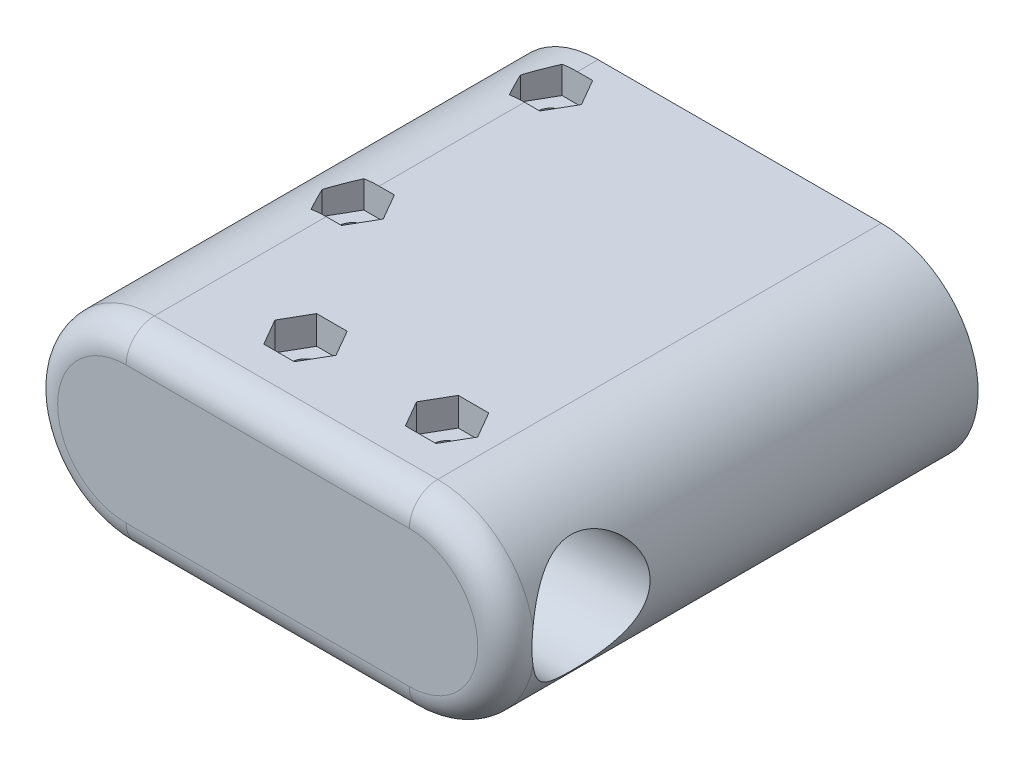
from build123d import *

# Parameters (mm, degrees)
SKETCH1_R           = 6.25
SKETCH1_R_2         = 4.25
BOSS_EXTRUDE1_DEPTH = 50
CUT_EXTRUDE1_DEPTH  = 127
BOSS_EXTRUDE2_DEPTH = 20
SKETCH4_R           = 6.25
CUT_EXTRUDE2_DEPTH  = 20
CUT_EXTRUDE3_START  = -30
SKETCH5_R           = 6.25
CUT_EXTRUDE3_DEPTH  = 30
FILLET1_R           = 3
SKETCH6_R           = 4.5
BOSS_EXTRUDE3_DEPTH = 30
SKETCH7_R           = 1.5
CUT_EXTRUDE4_DEPTH  = 30
CUT_EXTRUDE5_DEPTH  = 3


with BuildPart() as part:
    # Sketch1 → Boss-Extrude1 (new body)
    with BuildSketch(Plane.XY):
        with BuildLine():
            Line((-73.62208004, 11.83829087), (106.37791996, 11.83829087))
            ThreePointArc((106.37791996, 11.83829087), (116.62791996, 1.58829087), (106.37791996, -8.66170913))
            Line((106.37791996, -8.66170913), (-73.62208004, -8.66170913))
            ThreePointArc((-73.62208004, -8.66170913), (-83.87208004, 1.58829087), (-73.62208004, 11.83829087))
        make_face()
        with Locations((-73.62208004, 1.58829087)):
            Circle(SKETCH1_R, mode=Mode.SUBTRACT)
        with Locations((-43.62208004, 1.58829087)):
            Circle(SKETCH1_R_2, mode=Mode.SUBTRACT)
        with Locations(Location((76.37791996, 1.58829087, 0), (0, 0, 180))):
            Circle(SKETCH1_R_2, mode=Mode.SUBTRACT)
        with Locations(Location((106.37791996, 1.58829087, 0), (0, 0, 180))):
            Circle(SKETCH1_R, mode=Mode.SUBTRACT)
    extrude(amount=BOSS_EXTRUDE1_DEPTH)

    # Sketch2 → Cut-Extrude1 (cut)
    with BuildSketch(Plane.XY.offset(50)):
        with BuildLine():
            Line((-43.62208004, 11.83829087), (132.206329773, 11.83829087))
            Line((132.206329773, 11.83829087), (132.206329773, -8.66170913))
            Line((132.206329773, -8.66170913), (-43.62208004, -8.66170913))
            ThreePointArc((-43.62208004, -8.66170913), (-33.37208004, 1.58829087), (-43.62208004, 11.83829087))
        make_face()
    extrude(amount=-CUT_EXTRUDE1_DEPTH, mode=Mode.SUBTRACT)

    # Sketch3 → Boss-Extrude2 (add)
    with BuildSketch(Plane.XY.offset(50)):
        with BuildLine():
            Line((-43.62208004, 11.83829087), (-73.62208004, 11.83829087))
            ThreePointArc((-73.62208004, 11.83829087), (-83.87208004, 1.58829087), (-73.62208004, -8.66170913))
            Line((-73.62208004, -8.66170913), (-43.62208004, -8.66170913))
            ThreePointArc((-43.62208004, -8.66170913), (-33.37208004, 1.58829087), (-43.62208004, 11.83829087))
        make_face()
    extrude(amount=-BOSS_EXTRUDE2_DEPTH)

    # Sketch4 → Cut-Extrude2 (cut)
    with BuildSketch(Plane.ZY.offset(43.62208004)):
        with Locations(Location((41, 1.58829087, 0), (0, 0, 270))):
            Circle(SKETCH4_R)
    extrude(amount=-CUT_EXTRUDE2_DEPTH, mode=Mode.SUBTRACT)

    # Sketch5 → Cut-Extrude3 (cut)
    with BuildSketch(Plane(origin=(-43.62208004, 0, 0), x_dir=(0, 0, -1), z_dir=(1, 0, 0)).offset(CUT_EXTRUDE3_START)):
        with Locations(Location((-41, 1.58829087, 0), (0, 0, 270))):
            Circle(SKETCH5_R)
    extrude(amount=CUT_EXTRUDE3_DEPTH, mode=Mode.SUBTRACT)

    # Fillet1
    # the kernel refuses this fillet: 3 mm, written as the material it takes off along each edge
    with BuildSketch(Plane(origin=(-73.62208004, 11.83829087, 50), x_dir=(0, 0, -1), z_dir=(1, 0, 0)), Plane(origin=(-43.62208004, -8.66170913, 50), x_dir=(0, 0, -1), z_dir=(-1, 0, 0))) as fillet1_piece_1:
        with BuildLine():
            CenterArc((FILLET1_R, -FILLET1_R), FILLET1_R, 90, 90)
            Line((0, -FILLET1_R), (0, 0))
            Line((0, 0), (FILLET1_R, 0))
        make_face()
    extrude(amount=30, mode=Mode.SUBTRACT)
    with BuildSketch(Plane(origin=(-73.62208004, 1.58829087, 50), x_dir=(0, -1, 0), z_dir=(1, 0, 0))) as fillet1_piece_2:
        with BuildLine():
            CenterArc((10.25 - FILLET1_R, FILLET1_R), FILLET1_R, 270, 90)
            Line((10.25, FILLET1_R), (10.25, 0))
            Line((10.25, 0), (10.25 - FILLET1_R, 0))
        make_face()
    revolve(axis=Axis((-73.62208004, 1.58829087, 50), (0, 0, -1)), revolution_arc=180, mode=Mode.SUBTRACT)
    with BuildSketch(Plane(origin=(-43.62208004, 1.58829087, 50), x_dir=(0, -1, 0), z_dir=(-1, 0, 0))) as fillet1_piece_3:
        with BuildLine():
            CenterArc((10.25 - FILLET1_R, -FILLET1_R), FILLET1_R, 0, 90)
            Line((10.25 - FILLET1_R, 0), (10.25, 0))
            Line((10.25, 0), (10.25, -FILLET1_R))
        make_face()
    revolve(axis=Axis((-43.62208004, 1.58829087, 50), (0, 0, 1)), revolution_arc=180, mode=Mode.SUBTRACT)

    # Sketch6 → Boss-Extrude3 (add)
    with BuildSketch(Plane(origin=(0, 0, 30), x_dir=(-1, 0, 0), z_dir=(0, 0, -1))):
        with Locations(Location((73.62208004, 1.58829087, 0), (0, 0, 180))):
            Circle(SKETCH6_R)
    extrude(amount=BOSS_EXTRUDE3_DEPTH)

    # Sketch7 → Cut-Extrude4 (cut)
    with BuildSketch(Plane(origin=(0, 11.83829087, 0), x_dir=(1, 0, 0), z_dir=(0, 1, 0))):
        with Locations(Location((-48.62208004, -41, 0), (0, 0, 180))):
            Circle(SKETCH7_R)
        with Locations(Location((-63.62208004, -41, 0), (0, 0, 180))):
            Circle(SKETCH7_R)
        with Locations(Location((-73.62208004, -26, 0), (0, 0, 180))):
            Circle(SKETCH7_R)
        with Locations(Location((-73.62208004, -5, 0), (0, 0, 180))):
            Circle(SKETCH7_R)
    extrude(amount=-CUT_EXTRUDE4_DEPTH, mode=Mode.SUBTRACT)

    # Sketch9 → Cut-Extrude5 (cut)
    with BuildSketch(Plane(origin=(0, 11.83829087, 0), x_dir=(1, 0, 0), z_dir=(0, 1, 0))):
        Polygon((-60.388918533, -41), (-62.005499286, -38.2), (-65.238660794, -38.2), (-66.855241548, -41), (-65.238660794, -43.8), (-62.005499286, -43.8), align=None)
        Polygon((-45.388918533, -41), (-47.005499286, -38.2), (-50.238660794, -38.2), (-51.855241548, -41), (-50.238660794, -43.8), (-47.005499286, -43.8), align=None)
        Polygon((-70.388918533, -26), (-72.005499286, -23.2), (-75.238660794, -23.2), (-76.855241548, -26), (-75.238660794, -28.8), (-72.005499286, -28.8), align=None)
        Polygon((-70.388918533, -5), (-72.005499286, -2.2), (-75.238660794, -2.2), (-76.855241548, -5), (-75.238660794, -7.8), (-72.005499286, -7.8), align=None)
    extrude(amount=-CUT_EXTRUDE5_DEPTH, mode=Mode.SUBTRACT)


solid = part.part
